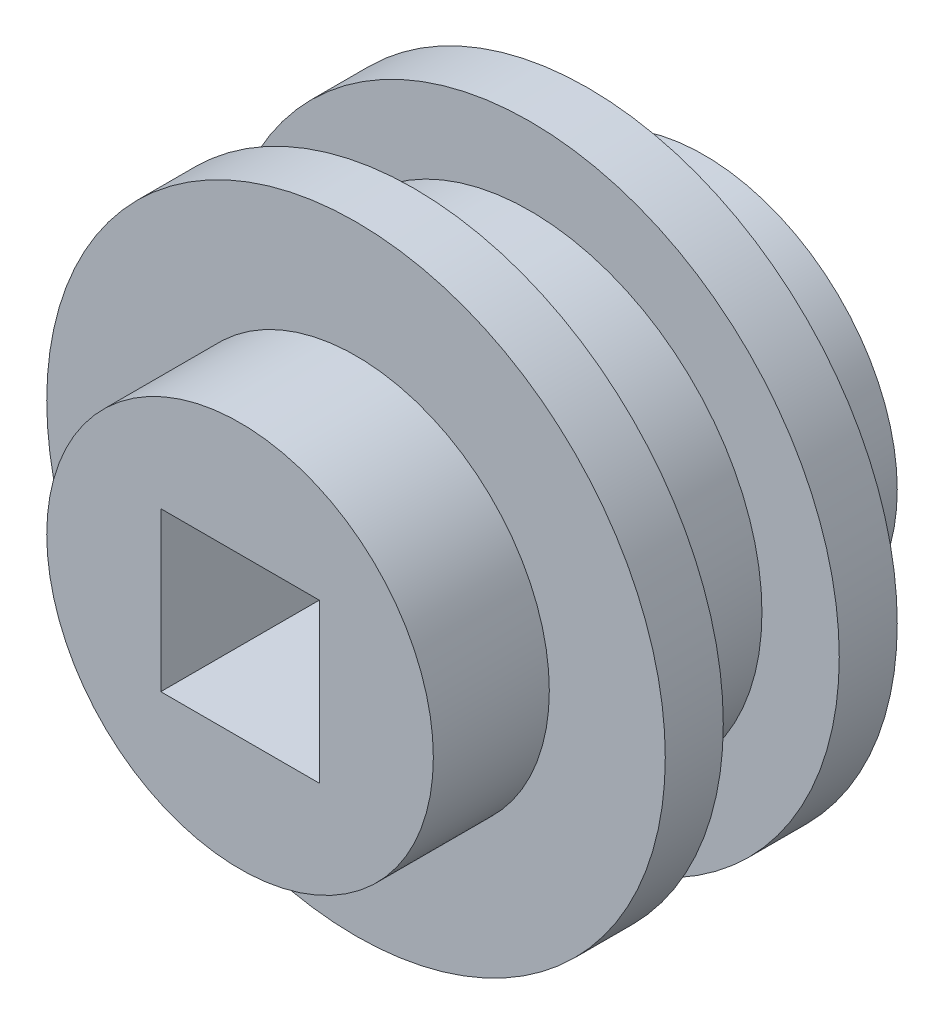
from build123d import *

# Parameters (mm, degrees)
SKETCH1_R               = 5
SKETCH1_W               = 4.1
SKETCH1_H               = 4.1
BOSS_EXTRUDE1_DEPTH     = 6
SKETCH1_3_R             = 8
SKETCH1_3_R_2           = 5
BOSS_EXTRUDE2_DEPTH     = 3
SKETCH1_6_R             = 8
SKETCH1_6_R_2           = 6
CUT_EXTRUDE_THIN1_DEPTH = 1.5


with BuildPart() as part:
    # Sketch1 → Boss-Extrude1 (new, symmetric)
    with BuildSketch(Plane.XY):
        Circle(SKETCH1_R)
        Rectangle(SKETCH1_W, SKETCH1_H, mode=Mode.SUBTRACT)
    extrude(amount=BOSS_EXTRUDE1_DEPTH, both=True)

    # Sketch1<3> → Boss-Extrude2 (add, symmetric)
    with BuildSketch(Plane.XY):
        Circle(SKETCH1_3_R)
        Circle(SKETCH1_3_R_2, mode=Mode.SUBTRACT)
    extrude(amount=BOSS_EXTRUDE2_DEPTH, both=True)

    # Sketch1<6> → Cut-Extrude-Thin1 (cut, symmetric)
    with BuildSketch(Plane.XY):
        Circle(SKETCH1_6_R)
        Circle(SKETCH1_6_R_2, mode=Mode.SUBTRACT)
    extrude(amount=CUT_EXTRUDE_THIN1_DEPTH, both=True, mode=Mode.SUBTRACT)


solid = part.part
